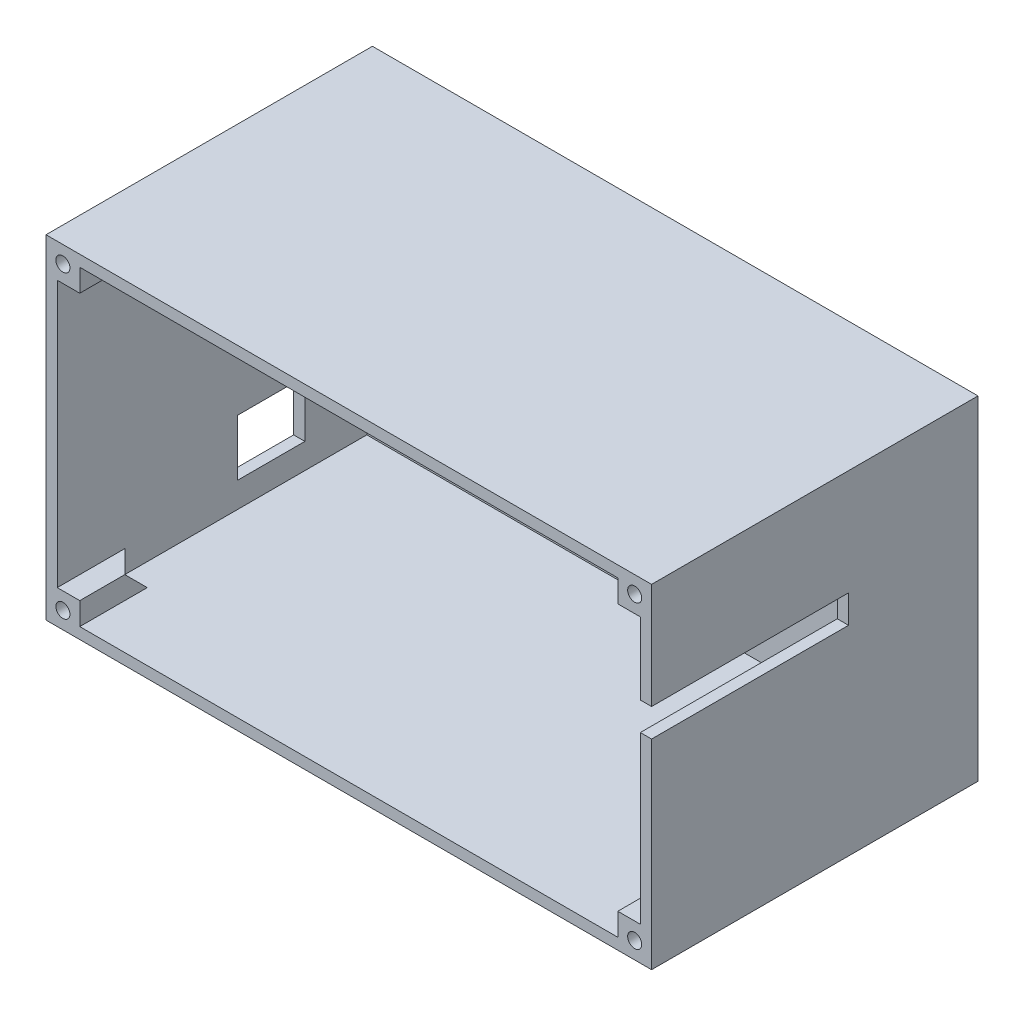
from build123d import *

# Parameters (mm, degrees)
SKETCH1_W           = 107.6
SKETCH1_H           = 59.3
SKETCH1_W_2         = 103.6
SKETCH1_H_2         = 55.3
BOSS_EXTRUDE1_DEPTH = 55
SKETCH2_W           = 107.6
SKETCH2_H           = 59.3
SKETCH2_R           = 1.5
BOSS_EXTRUDE2_DEPTH = 3
SKETCH3_R           = 2.5
CUT_EXTRUDE1_DEPTH  = 1.5
SKETCH4_W           = 12
SKETCH4_H           = 10
CUT_EXTRUDE2_DEPTH  = 5
SKETCH5_W           = 35
SKETCH5_H           = 5
CUT_EXTRUDE3_DEPTH  = 5
SKETCH8_R           = 1.75
CUT_EXTRUDE4_DEPTH  = 10
CHAMFER1_SIZE       = 2
SKETCH9_W           = 4
SKETCH9_H           = 4
BOSS_EXTRUDE4_DEPTH = 8
CHAMFER2_SIZE       = 4
SKETCH10_R          = 1.25
CUT_EXTRUDE5_DEPTH  = 5


with BuildPart() as part:
    # Sketch1 → Boss-Extrude1 (new body)
    with BuildSketch(Plane.XY):
        with Locations((53.8, 29.65)):
            Rectangle(SKETCH1_W, SKETCH1_H)
        with Locations((53.8, 29.65)):
            Rectangle(SKETCH1_W_2, SKETCH1_H_2, mode=Mode.SUBTRACT)
    extrude(amount=BOSS_EXTRUDE1_DEPTH)

    # Sketch2 → Boss-Extrude2 (add)
    with BuildSketch(Plane(origin=(0, 0, 0), x_dir=(-1, 0, 0), z_dir=(0, 0, -1))):
        with Locations((-53.8, 29.65)):
            Rectangle(SKETCH2_W, SKETCH2_H)
        with Locations((-18.3, 53.7)):
            Circle(SKETCH2_R, mode=Mode.SUBTRACT)
        with Locations((-17, 5.5)):
            Circle(SKETCH2_R, mode=Mode.SUBTRACT)
        with Locations((-93.2, 53.7)):
            Circle(SKETCH2_R, mode=Mode.SUBTRACT)
        with Locations((-99.5, 5.5)):
            Circle(SKETCH2_R, mode=Mode.SUBTRACT)
    extrude(amount=BOSS_EXTRUDE2_DEPTH)

    # Sketch3 → Cut-Extrude1 (cut)
    with BuildSketch(Plane(origin=(0, 0, -3), x_dir=(-1, 0, 0), z_dir=(0, 0, -1))):
        with Locations((-93.2, 53.7)):
            Circle(SKETCH3_R)
        with Locations((-18.3, 53.7)):
            Circle(SKETCH3_R)
        with Locations((-17, 5.5)):
            Circle(SKETCH3_R)
        with Locations((-99.5, 5.5)):
            Circle(SKETCH3_R)
    extrude(amount=-CUT_EXTRUDE1_DEPTH, mode=Mode.SUBTRACT)

    # Sketch4 → Cut-Extrude2 (cut)
    with BuildSketch(Plane.ZY):
        with Locations((17, 11.5)):
            Rectangle(SKETCH4_W, SKETCH4_H)
    extrude(amount=-CUT_EXTRUDE2_DEPTH, mode=Mode.SUBTRACT)

    # Sketch5 → Cut-Extrude3 (cut)
    with BuildSketch(Plane(origin=(107.6, 0, 0), x_dir=(0, 0, -1), z_dir=(1, 0, 0))):
        with Locations((-37.5, 38)):
            Rectangle(SKETCH5_W, SKETCH5_H)
    extrude(amount=-CUT_EXTRUDE3_DEPTH, mode=Mode.SUBTRACT)

    # Sketch8 → Cut-Extrude4 (cut)
    with BuildSketch(Plane.XY):
        with Locations((10, 51.3)):
            Circle(SKETCH8_R)
        with Locations((85, 51.3)):
            Circle(SKETCH8_R)
        with Locations((85, 7.3)):
            Circle(SKETCH8_R)
        with Locations((10, 7.3)):
            Circle(SKETCH8_R)
    extrude(amount=-CUT_EXTRUDE4_DEPTH, mode=Mode.SUBTRACT)

    # Chamfer1
    chamfer1_edges = [part.edges().sort_by_distance(p)[0] for p in [
        (8.25, 7.3, 0),
        (83.25, 7.3, 0),
        (83.25, 51.3, 0),
        (8.25, 51.3, 0),
    ]]
    chamfer(chamfer1_edges, length=CHAMFER1_SIZE)

    # Sketch9 → Boss-Extrude4 (add)
    with BuildSketch(Plane.XY.offset(55)):
        with Locations((4, 4)):
            Rectangle(SKETCH9_W, SKETCH9_H)
        with Locations((103.6, 55.3)):
            Rectangle(SKETCH9_W, SKETCH9_H)
        with Locations((103.6, 4)):
            Rectangle(SKETCH9_W, SKETCH9_H)
        with Locations((4, 55.3)):
            Rectangle(SKETCH9_W, SKETCH9_H)
    extrude(amount=-BOSS_EXTRUDE4_DEPTH)

    # Chamfer2
    chamfer2_edges = [part.edges().sort_by_distance(p)[0] for p in [
        (4, 57.3, 47),
        (2, 55.3, 47),
        (4, 2, 47),
        (2, 4, 47),
        (105.6, 4, 47),
        (103.6, 2, 47),
        (103.6, 57.3, 47),
        (105.6, 55.3, 47),
    ]]
    chamfer(chamfer2_edges, length=CHAMFER2_SIZE - 0.0001)  # a hair under: the kernel refuses the full size

    # Sketch10 → Cut-Extrude5 (cut)
    with BuildSketch(Plane.XY.offset(55)):
        with Locations((3, 56.3)):
            Circle(SKETCH10_R)
        with Locations((104.6, 56.3)):
            Circle(SKETCH10_R)
        with Locations((104.6, 3)):
            Circle(SKETCH10_R)
        with Locations((3, 3)):
            Circle(SKETCH10_R)
    extrude(amount=-CUT_EXTRUDE5_DEPTH, mode=Mode.SUBTRACT)


solid = part.part
